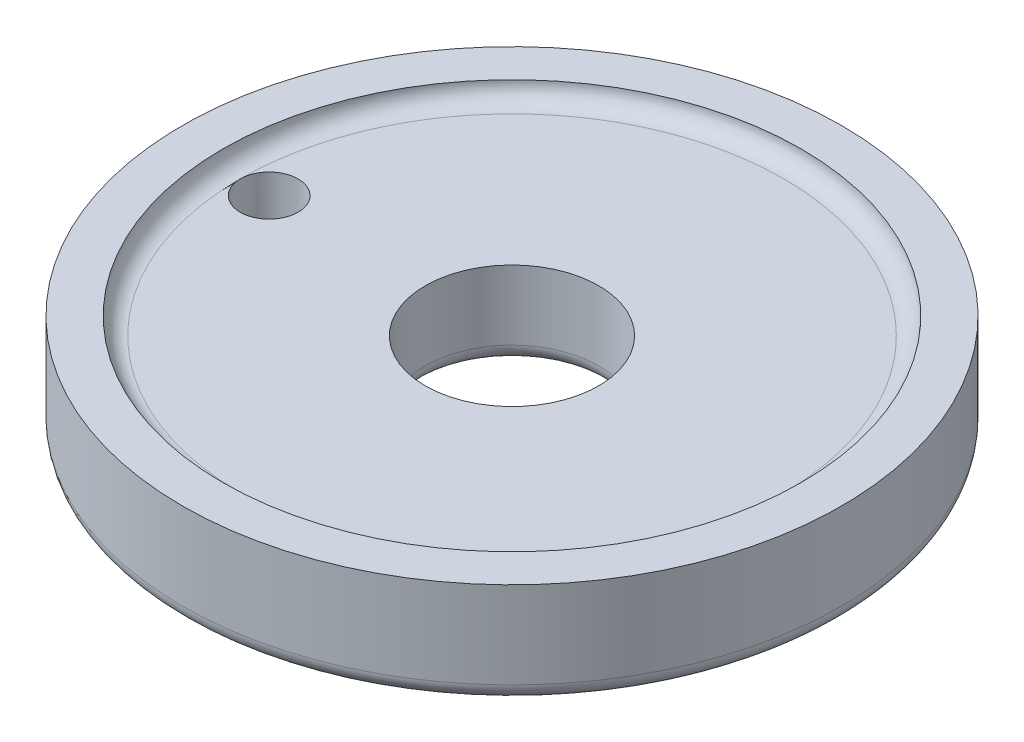
from build123d import *

# Parameters (mm, degrees)
SKETCH1_R           = 57
SKETCH1_R_2         = 15
SKETCH1_R_3         = 5
BOSS_EXTRUDE1_DEPTH = 18
FILLET1_R           = 3
SKETCH2_R           = 50
SKETCH2_R_2         = 15
CUT_EXTRUDE1_DEPTH  = 3
FILLET2_R           = 3


with BuildPart() as part:
    # Sketch1 → Boss-Extrude1 (new body)
    with BuildSketch(Plane(origin=(0, 0, 0), x_dir=(1, 0, 0), z_dir=(0, 1, 0))):
        with Locations(Location((0, 0, 0), (0, 0, 270))):
            Circle(SKETCH1_R)
        with Locations(Location((0, 0, 0), (0, 0, 270))):
            Circle(SKETCH1_R_2, mode=Mode.SUBTRACT)
        with Locations(Location((-42, 0, 0), (0, 0, 270))):
            Circle(SKETCH1_R_3, mode=Mode.SUBTRACT)
    extrude(amount=-BOSS_EXTRUDE1_DEPTH)

    # Fillet1
    fillet1_edges = [part.edges().sort_by_distance(p)[0] for p in [
        (0, -18, -57),
        (0, -18, -15),
    ]]
    fillet(fillet1_edges, radius=FILLET1_R)

    # Sketch2 → Cut-Extrude1 (cut)
    with BuildSketch(Plane(origin=(0, 0, 0), x_dir=(1, 0, 0), z_dir=(0, 1, 0))):
        with Locations(Location((0, 0, 0), (0, 0, 270))):
            Circle(SKETCH2_R)
        with Locations(Location((0, 0, 0), (0, 0, 270))):
            Circle(SKETCH2_R_2, mode=Mode.SUBTRACT)
    extrude(amount=-CUT_EXTRUDE1_DEPTH, mode=Mode.SUBTRACT)

    # Fillet2
    fillet2_edges = [part.edges().sort_by_distance(p)[0] for p in [
        (0, -3, -50),
    ]]
    fillet(fillet2_edges, radius=FILLET2_R - 0.0001)  # a hair under: the kernel refuses the full size


solid = part.part
